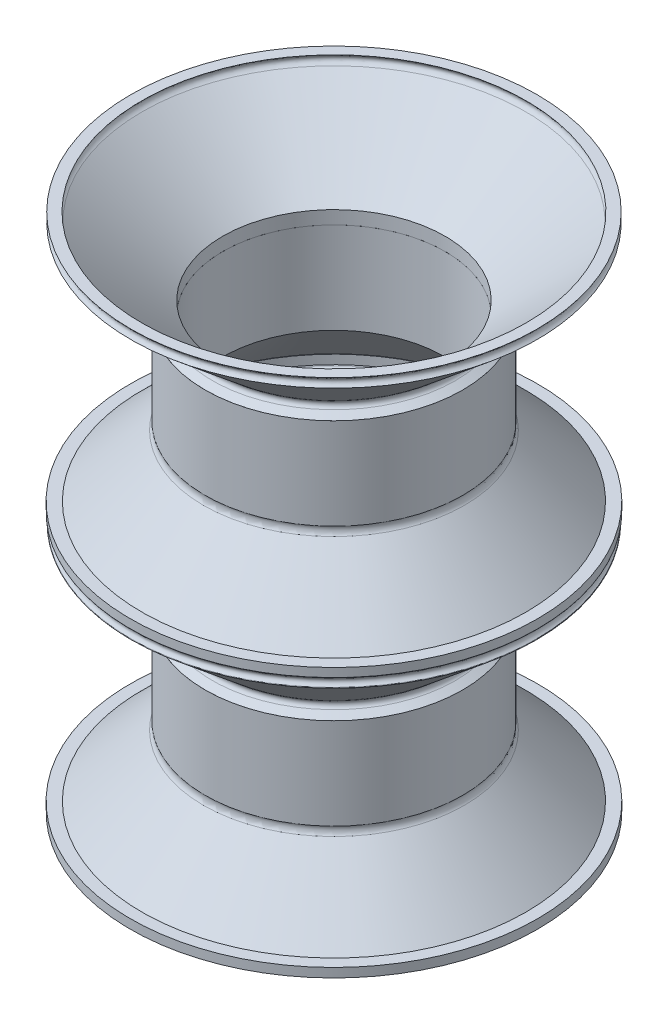
from build123d import *

# Parameters (mm, degrees)
ACTIVE_FILLET_R     = 0.5
SKETCH11_R          = 14.103676921920666
SKETCH11_R_2        = 12.180725781348816
COLLAR_DEPTH        = 10
PASSIVE_FILLET_R    = 0.8
SKETCH18_R          = 22.29457906148835
SKETCH18_R_2        = 19.738102711916127
BOSS_EXTRUDE4_DEPTH = 1
FILLET3_R           = 0.05
FILLET4_R           = 0.05


# Read off the part's stored shape, not the designer's step: Body-Move/Copy2
with BuildPart() as part:
    # Sketch1 → Main Active (revolve)
    with BuildSketch(Plane.XY):
        Polygon((-0.44430417046757187, 0), (-9.97833291122136, 8), (-8.733753849733018, 8), (0.08552036891816808, 0.5997502558785777), (0.08552036891816808, -0.8481847341285212), (-1.8374307716536824, -0.8481847341285211), align=None)
    revolve(axis=Axis((12.266246150266982, 7.609018032819944, 0), (1.1e-16, -1, 0)))

    # Active fillet
    active_fillet_edges = [part.edges().sort_by_distance(p)[0] for p in [
        (24.976796471001535, 3.23e-15, -1.56e-15),
    ]]
    fillet(active_fillet_edges, radius=ACTIVE_FILLET_R)

    # Sketch17 → Neck Curve (revolve)
    with BuildSketch(Plane.XY, mode=Mode.PRIVATE) as neck_curve_sk:
        with BuildLine():
            Line((-9.978332911221361, 8), (-8.733753849733016, 8))
            add(Edge.make_bspline(
                [(-8.733753849733016, 8), (-9.417134243608169, 8.454758024892763), (-8.796578828718458, 9.000000000000004)],
                knots=[0, 0, 0, 1, 1, 1], degree=2))
            Line((-8.796578828718458, 9.000000000000004), (-9.978332911221361, 9.000000000000004))
            add(Edge.make_bspline(
                [(-9.978332911221361, 8), (-9.322292514147533, 8.483356916822304), (-9.978332911221361, 9.000000000000004)],
                knots=[0, 0, 0, 1, 1, 1], degree=2))
        make_face()
    revolve(neck_curve_sk.sketch.rotate(Axis((12.266246150266984, -19.969844330252183, 0), (-1.2e-16, 1, 0)), 180), axis=Axis((12.266246150266984, -19.969844330252183, 0), (-1.2e-16, 1, 0)))

    # Fillet3
    fillet3_edges = [part.edges().sort_by_distance(p)[0] for p in [
        (12.266246150266975, 8.000000000000002, -22.24457906148834),
    ]]
    fillet(fillet3_edges, radius=FILLET3_R)


with BuildPart() as body_2:
    # Sketch11 → collar (new body)
    with BuildSketch(Plane.XZ.offset(0.848184734128521)):
        with Locations((12.266246150266984, 0)):
            Circle(SKETCH11_R)
        with Locations((12.266246150266984, 0)):
            Circle(SKETCH11_R_2, mode=Mode.SUBTRACT)
    extrude(amount=COLLAR_DEPTH)

    # Sketch14 → Passive Element (revolve)
    with BuildSketch(Plane.XY, mode=Mode.PRIVATE) as passive_element_sk:
        Polygon((-1.1589875659701498, -10.848184734128521), (-8.766364496537454, -18.455561664695857), (-7.521856561649136, -18.45556166469586), (0.08552036891816897, -10.848184734128521), align=None)
    revolve(passive_element_sk.sketch.rotate(Axis((12.266246150266984, -19.969844330252183, 0), (-1.2e-16, 1, 0)), 180), axis=Axis((12.266246150266984, -19.969844330252183, 0), (-1.2e-16, 1, 0)))

    # Passive Fillet
    # the kernel refuses this fillet: 0.8 mm, written as the material it adds along each edge
    with BuildSketch(Plane(origin=(12.266246150266982, -10.84818473412852, 0), x_dir=(1, 1.3e-16, 1.2e-16), z_dir=(-1.2e-16, 0, 1))) as passive_fillet_piece_1:
        with BuildLine():
            CenterArc((14.848517187625331, -0.2919126214897256), PASSIVE_FILLET_R, 158.5991389184751, 66.40086108152474)
            Line((14.282831762676091, -0.8575980464389624), (14.271518054177106, -0.8689117549379476))
            Line((14.271518054177106, -0.8689117549379476), (13.413920007738147, -0.01131370849898516))
            Line((13.413920007738147, -0.01131370849898516), (13.425233716237132, 0.01600000000000001))
            ThreePointArc((13.425233716237132, 0.01600000000000001), (13.764455319078904, 0.01599999999999997), (14.088780116606573, 0.00583825242979499))
            Line((14.088780116606573, 0.00583825242979499), (14.103676921920668, -9e-17))
        make_face()
    revolve(axis=Axis((12.266246150266982, -10.84818473412852, 0), (-1.2e-16, 1, 0)))

    # Sketch18 → Boss-Extrude4 (add)
    with BuildSketch(Plane.XZ.offset(18.455561664695857)):
        with Locations((12.266246150266984, 0)):
            Circle(SKETCH18_R)
        with Locations((12.266246150266984, 0)):
            Circle(SKETCH18_R_2, mode=Mode.SUBTRACT)
    extrude(amount=BOSS_EXTRUDE4_DEPTH)


with BuildPart() as body_3:
    # Body-Move/Copy2 outline → Body-Move/Copy2 (revolve)
    with BuildSketch(Plane(origin=(12.26624615, 0, 0), x_dir=(1, 0, 0), z_dir=(0, 0, 1))):
        with BuildLine():
            Line((14.103676922, 27.601815266), (13.305602068, 28.087711456))
            ThreePointArc((13.305602068, 28.087711456), (13.067048008, 28.477010025), (13.24422527, 28.897806453))
            Line((13.24422527, 28.897806453), (22.244579061, 36.45))
            add(Edge.make_bspline(
                [(22.244579061, 37.45), (21.58853866441453, 36.9333569168223), (22.244579061, 36.45)],
                knots=[0, 0, 0, 1, 1, 1], degree=2))
            Line((22.244579061, 37.45), (21.062824979, 37.45))
            add(Edge.make_bspline(
                [(21.062824979, 37.45), (21.683380393875126, 36.904758024892814), (21, 36.45)],
                knots=[0.04818103665717954, 0.04818103665717954, 0.04818103665717954, 1.048181036657181, 1.048181036657181, 1.048181036657181], degree=2))
            Line((21, 36.45), (12.180725781, 29.049750256))
            Line((12.180725781, 29.049750256), (12.180725781, 27.601815266))
            Line((12.180725781, 27.601815266), (14.103676922, 27.601815266))
        make_face()
    revolve(axis=Axis((12.26624615, 0, 0), (0, 1, 0)))


with BuildPart() as body_4:
    # Body-Move_Copy2 2 outline → Body-Move_Copy2 2 (revolve)
    with BuildSketch(Plane(origin=(12.26624615, 0, 0), x_dir=(1, 0, 0), z_dir=(0, 0, 1))):
        with BuildLine():
            Line((14.103676922, 27.601815266), (12.180725781, 27.601815266))
            Line((12.180725781, 27.601815266), (12.180725781, 17.601815266))
            Line((12.180725781, 17.601815266), (19.788102712, 9.994438335))
            Line((19.788102712, 9.994438335), (19.738102712, 9.994438335))
            Line((19.738102712, 9.994438335), (19.738102712, 8.994438335))
            Line((19.738102712, 8.994438335), (22.294579061, 8.994438335))
            Line((22.294579061, 8.994438335), (22.294579061, 9.994438335))
            Line((22.294579061, 9.994438335), (21.032610647, 9.994438335))
            Line((21.032610647, 9.994438335), (14.282831763, 16.744217219))
            ThreePointArc((14.282831763, 16.744217219), (14.065422047, 17.146311687), (14.103676922, 17.601815266))
            Line((14.103676922, 17.601815266), (14.103676922, 27.601815266))
        make_face()
    revolve(axis=Axis((12.26624615, 0, 0), (0, 1, 0)))

    # Fillet4
    fillet4_edges = [body_4.edges().sort_by_distance(p)[0] for p in [
        (-10.028332911, 8.994438335, -2.73e-15),
    ]]
    fillet(fillet4_edges, radius=FILLET4_R)


solid = Compound([part.part, body_2.part, body_3.part, body_4.part])
